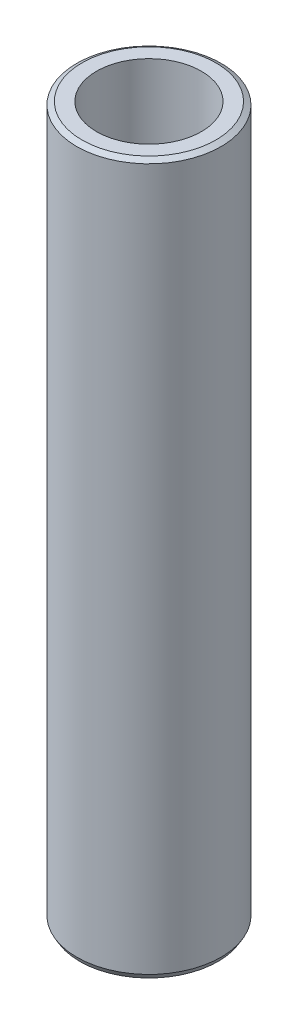
from build123d import *
from OCP.BRepFilletAPI import BRepFilletAPI_MakeChamfer

# Parameters (mm, degrees)
SKETCH1_R           = 60
BOSS_EXTRUDE1_DEPTH = 590.474866779
SKETCH2_R           = 43.576412566
CUT_EXTRUDE1_DEPTH  = 597.540500132
CHAMFER1_SIZE       = 2.523437065
CHAMFER1_SIZE2      = 4.370721206


with BuildPart() as part:
    # Sketch1 → Boss-Extrude1 (new body)
    with BuildSketch(Plane(origin=(0, 0, 0), x_dir=(1, 0, 0), z_dir=(0, 1, 0))):
        Circle(SKETCH1_R)
    extrude(amount=BOSS_EXTRUDE1_DEPTH)

    # Sketch2 → Cut-Extrude1 (cut, through all)
    with BuildSketch(Plane(origin=(0, 0, 0), x_dir=(1, 0, 0), z_dir=(0, 1, 0))):
        Circle(SKETCH2_R)
    extrude(amount=CUT_EXTRUDE1_DEPTH, mode=Mode.SUBTRACT)

    # Chamfer1: one chamfer whose edges measure the first distance from different faces: ONE call of the kernel's chamfer builder (chamfer() names one face for all edges)
    chamfer1_edges_1 = [part.edges().sort_by_distance(p)[0] for p in [
        (-60, 590.474866779, 0),
    ]]
    chamfer1_side_1 = [part.faces().sort_by_distance(p)[0] for p in [
        (-60, 295.237433389, 0),
    ]]
    chamfer1_edges_2 = [part.edges().sort_by_distance(p)[0] for p in [
        (-60, 0, 0),
    ]]
    chamfer1_side_2 = [part.faces().sort_by_distance(p)[0] for p in [
        (-58.302943725, 0, 0),
    ]]
    chamfer1 = BRepFilletAPI_MakeChamfer(part.part.solid().wrapped)
    for e in chamfer1_edges_1:
        chamfer1.Add(CHAMFER1_SIZE, CHAMFER1_SIZE2, e.wrapped, chamfer1_side_1[0].wrapped)  # the first distance lies on this face
    for e in chamfer1_edges_2:
        chamfer1.Add(CHAMFER1_SIZE, CHAMFER1_SIZE2, e.wrapped, chamfer1_side_2[0].wrapped)  # the first distance lies on this face
    add(Compound.cast(chamfer1.Shape()), mode=Mode.REPLACE)


solid = part.part
